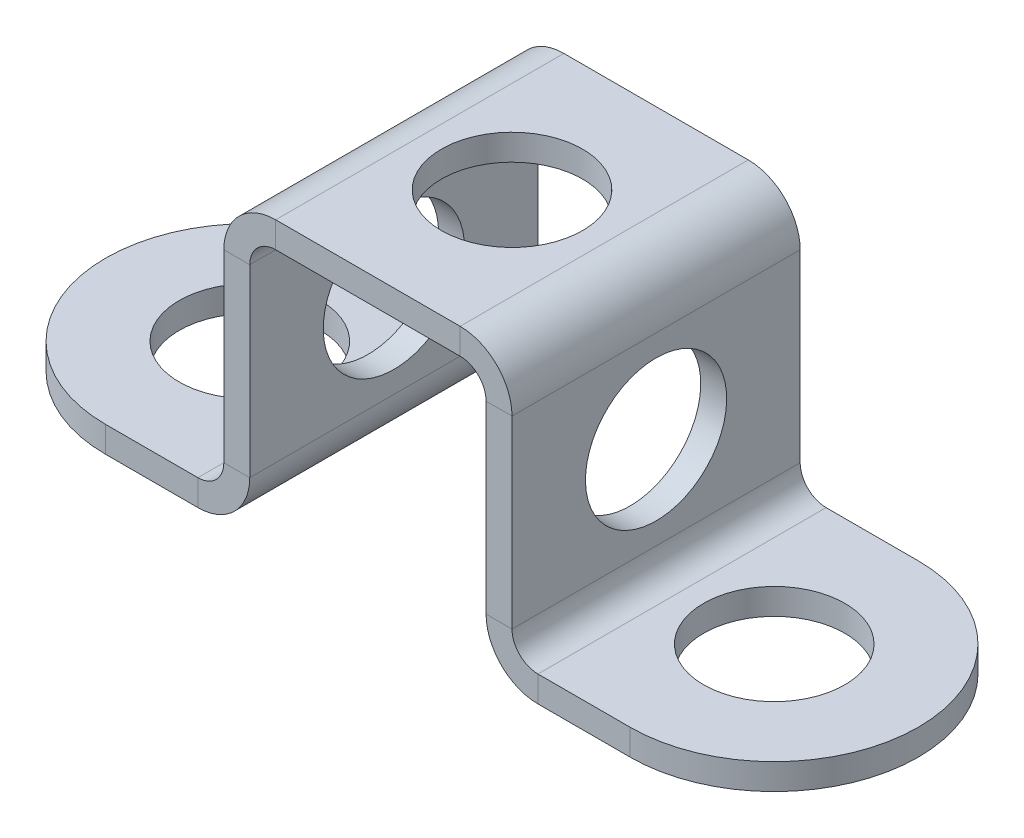
from build123d import *

# Parameters (mm, degrees)
SKETCH1_W                      = 10
SKETCH1_H                      = 10
SKETCH1_R                      = 2.45
BASE_FLANGE1_DEPTH             = 0.9
EDGE_FLANGE1_STRIP_W           = 5.4
EDGE_FLANGE1_STRIP_H           = 0.9
EDGE_FLANGE1_STRIP_CUT_DEPTH   = 10
EDGE_FLANGE1_STRIP_2_W         = 5.4
EDGE_FLANGE1_STRIP_2_H         = 0.9
EDGE_FLANGE1_STRIP_CUT_2_DEPTH = 10
EDGE_FLANGE1_DEPTH             = 10
EDGE_FLANGE1_BEND_DEPTH        = 10
EDGE_FLANGE2_STRIP_W           = 5.4
EDGE_FLANGE2_STRIP_H           = 0.9
EDGE_FLANGE2_STRIP_CUT_DEPTH   = 10
EDGE_FLANGE2_STRIP_2_W         = 5.4
EDGE_FLANGE2_STRIP_2_H         = 0.9
EDGE_FLANGE2_STRIP_CUT_2_DEPTH = 10
EDGE_FLANGE2_DEPTH             = 10
EDGE_FLANGE2_BEND_DEPTH        = 10
HOLE1_OUTLINE_R                = 2.45
HOLE1_DEPTH                    = 10
SKETCH21_R                     = 2.45
CUT_EXTRUDE1_DEPTH             = 10


# Read off the part's stored shape, not the designer's step: Hole1
# Sheet-metal steps are written as plain solids
with BuildPart() as part:
    # Sketch1 → Base-Flange1 (new body)
    with BuildSketch(Plane(origin=(0, 0, 0), x_dir=(1, 0, 0), z_dir=(0, 1, 0))):
        with Locations((5, 5)):
            Rectangle(SKETCH1_W, SKETCH1_H)
        with Locations(Location((5, 5, 0), (0, 0, 270))):
            Circle(SKETCH1_R, mode=Mode.SUBTRACT)
    extrude(amount=-BASE_FLANGE1_DEPTH)

    # Edge-Flange1 strip (across the edge) → Edge-Flange1 strip cut (cut)
    with BuildSketch(Plane(origin=(10, -0.9, -10), x_dir=(-1, 0, 0), z_dir=(0, 0, 1))):
        with Locations((-0.9, -0.45)):
            Rectangle(EDGE_FLANGE1_STRIP_W, EDGE_FLANGE1_STRIP_H)
    extrude(amount=EDGE_FLANGE1_STRIP_CUT_DEPTH, mode=Mode.SUBTRACT)

    # Edge-Flange1 strip 2 (across the edge) → Edge-Flange1 strip cut 2 (cut)
    with BuildSketch(Plane(origin=(0, -0.9, 0), x_dir=(1, 0, 0), z_dir=(0, 0, -1))):
        with Locations((-0.9, -0.45)):
            Rectangle(EDGE_FLANGE1_STRIP_2_W, EDGE_FLANGE1_STRIP_2_H)
    extrude(amount=EDGE_FLANGE1_STRIP_CUT_2_DEPTH, mode=Mode.SUBTRACT)

    # Edge-Flange1 section (across the edge) → Edge-Flange1 (add)
    with BuildSketch(Plane(origin=(10, -0.9, -10), x_dir=(-1, 0, 0), z_dir=(0, 0, 1))):
        with BuildLine():
            Line((0, 0.9), (0, 9.1))
            Line((0, 9.1), (0.9, 9.1))
            Line((0.9, 9.1), (0.9, 0.9))
            ThreePointArc((0.9, 0.9), (1.163603897, 0.263603897), (1.8, 0))
            Line((1.8, 0), (1.8, -0.9))
            ThreePointArc((1.8, -0.9), (0.527207794, -0.372792206), (0, 0.9))
        make_face()
    extrude(amount=EDGE_FLANGE1_DEPTH)

    # Edge-Flange1 section 2 (across the edge) → Edge-Flange1 bend (add)
    with BuildSketch(Plane(origin=(0, -0.9, 0), x_dir=(1, 0, 0), z_dir=(0, 0, -1))):
        with BuildLine():
            Line((0, 0.9), (0, 9.1))
            Line((0, 9.1), (0.9, 9.1))
            Line((0.9, 9.1), (0.9, 0.9))
            ThreePointArc((0.9, 0.9), (1.163603897, 0.263603897), (1.8, 0))
            Line((1.8, 0), (1.8, -0.9))
            ThreePointArc((1.8, -0.9), (0.527207794, -0.372792206), (0, 0.9))
        make_face()
    extrude(amount=EDGE_FLANGE1_BEND_DEPTH)

    # Edge-Flange2 strip (across the edge) → Edge-Flange2 strip cut (cut)
    with BuildSketch(Plane(origin=(10, -10, 0), x_dir=(0, 1, 0), z_dir=(0, 0, -1))):
        with Locations((-0.9, -0.45)):
            Rectangle(EDGE_FLANGE2_STRIP_W, EDGE_FLANGE2_STRIP_H)
    extrude(amount=EDGE_FLANGE2_STRIP_CUT_DEPTH, mode=Mode.SUBTRACT)

    # Edge-Flange2 strip 2 (across the edge) → Edge-Flange2 strip cut 2 (cut)
    with BuildSketch(Plane(origin=(0, -10, -10), x_dir=(0, 1, 0), z_dir=(0, 0, 1))):
        with Locations((-0.9, -0.45)):
            Rectangle(EDGE_FLANGE2_STRIP_2_W, EDGE_FLANGE2_STRIP_2_H)
    extrude(amount=EDGE_FLANGE2_STRIP_CUT_2_DEPTH, mode=Mode.SUBTRACT)

    # Edge-Flange2 section (across the edge) → Edge-Flange2 (add)
    with BuildSketch(Plane(origin=(10, -10, 0), x_dir=(0, 1, 0), z_dir=(0, 0, -1))):
        with BuildLine():
            Line((0, 0.9), (0, 9.1))
            Line((0, 9.1), (0.9, 9.1))
            Line((0.9, 9.1), (0.9, 0.9))
            ThreePointArc((0.9, 0.9), (1.163603897, 0.263603897), (1.8, 0))
            Line((1.8, 0), (1.8, -0.9))
            ThreePointArc((1.8, -0.9), (0.527207794, -0.372792206), (0, 0.9))
        make_face()
    extrude(amount=EDGE_FLANGE2_DEPTH)

    # Edge-Flange2 section 2 (across the edge) → Edge-Flange2 bend (add)
    with BuildSketch(Plane(origin=(0, -10, -10), x_dir=(0, 1, 0), z_dir=(0, 0, 1))):
        with BuildLine():
            Line((0, 0.9), (0, 9.1))
            Line((0, 9.1), (0.9, 9.1))
            Line((0.9, 9.1), (0.9, 0.9))
            ThreePointArc((0.9, 0.9), (1.163603897, 0.263603897), (1.8, 0))
            Line((1.8, 0), (1.8, -0.9))
            ThreePointArc((1.8, -0.9), (0.527207794, -0.372792206), (0, 0.9))
        make_face()
    extrude(amount=EDGE_FLANGE2_BEND_DEPTH)

    # Hole1 outline → Hole1 (cut)
    with BuildSketch(Plane.YZ):
        with Locations((-5, -5)):
            Circle(HOLE1_OUTLINE_R)
    extrude(amount=HOLE1_DEPTH, mode=Mode.SUBTRACT)

    # Sketch21 → Cut-Extrude1 (cut)
    with BuildSketch(Plane(origin=(0, -9.1, 0), x_dir=(1, 0, 0), z_dir=(0, 1, 0))):
        with Locations(Location((14.1, 5, 0), (0, 0, 270))):
            Circle(SKETCH21_R)
        with Locations(Location((-4.1, 5, 0), (0, 0, 90))):
            Circle(SKETCH21_R)
        with BuildLine():
            Line((-4.1, 10), (-4.552354971, 12.340568082))
            Line((-4.552354971, 12.340568082), (-11.187715638, 12.084129022))
            Line((-11.187715638, 12.084129022), (-11.412099815, 3.1728717))
            Line((-11.412099815, 3.1728717), (-10.931276579, -1.41097649))
            Line((-10.931276579, -1.41097649), (-3.526598732, -3.206049908))
            Line((-3.526598732, -3.206049908), (-4.1, 0))
            ThreePointArc((-4.1, 0), (-9.1, 5), (-4.1, 10))
        make_face()
        with BuildLine():
            Line((14.1, 10), (20.065794752, 12.917555966))
            Line((20.065794752, 12.917555966), (23.30333788, -2.532897376))
            Line((23.30333788, -2.532897376), (14.680574501, -2.532897376))
            Line((14.680574501, -2.532897376), (14.1, 0))
            ThreePointArc((14.1, 0), (19.1, 5), (14.1, 10))
        make_face()
    extrude(amount=-CUT_EXTRUDE1_DEPTH, mode=Mode.SUBTRACT)


solid = part.part
